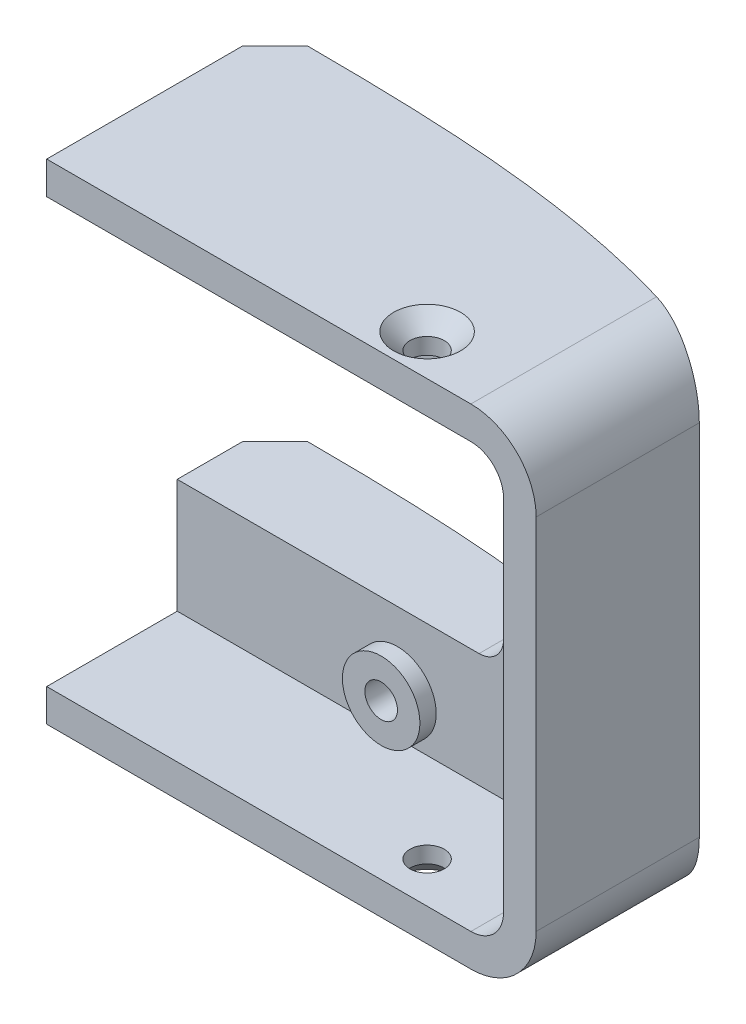
from build123d import *

# Parameters (mm, degrees)
SKETCH_2_W                    = 30
SKETCH_2_H                    = 30
EXTRUDE_1_DEPTH               = 10
SHELL_1_T                     = -2
CUT_EXTRUDE_1_REACH           = 34.104
SKETCH_3_W                    = 28
SKETCH_3_H                    = 26
EXTRUDE_2_DEPTH               = 30
CUT_EXTRUDE_2_DEPTH           = 34.566112599
SKETCH_6_R                    = 2.375
EXTRUDE_3_DEPTH               = 1
SKETCH_7_R                    = 1
CUT_EXTRUDE_3_DEPTH           = 3
CUT_EXTRUDE_3_DRAFT           = -2
CUT_EXTRUDE_3_PROFILE_2_DEPTH = 3
CUT_EXTRUDE_3_PROFILE_2_DRAFT = -2
CUT_EXTRUDE_3_PROFILE_3_DEPTH = 3
CUT_EXTRUDE_3_PROFILE_3_DRAFT = -2
CUT_EXTRUDE_3_PROFILE_4_DEPTH = 3
CUT_EXTRUDE_3_PROFILE_4_DRAFT = -2
FILLET_2_R                    = 2
FILLET_3_R                    = 4
SKETCH_8_R                    = 1.05
CUT_EXTRUDE_4_DEPTH           = 38.710498044
CHAMFER_1_SIZE                = 1
CHAMFER_2_SIZE                = 2.001261587
CHAMFER_2_SIZE_2              = 2


with BuildPart() as part:
    # 草图2 → 凸台-拉伸1 (new body)
    with BuildSketch(Plane.XY):
        with Locations((3.057614324, -9.588661073)):
            Rectangle(SKETCH_2_W, SKETCH_2_H)
    extrude(amount=-EXTRUDE_1_DEPTH)

    # 抽壳1
    shell_1_openings = [part.faces().sort_by_distance(p)[0] for p in [
        (-11.942385676, -9.588661073, -5),
    ]]
    offset(amount=SHELL_1_T, openings=shell_1_openings, kind=Kind.INTERSECTION)

    # 草图3 → 切除-拉伸1 (cut, up to next)
    with BuildSketch(Plane.XY, mode=Mode.PRIVATE) as cut_extrude_1_sk1:
        with Locations((2.057614324, -9.588661073)):
            Rectangle(SKETCH_3_W, SKETCH_3_H)
    cut_extrude_1_tool1 = extrude(cut_extrude_1_sk1.sketch, amount=-CUT_EXTRUDE_1_REACH, mode=Mode.PRIVATE) & part.part
    add(cut_extrude_1_tool1.solids().sort_by_distance((2.057614, -9.588661, 0))[0], mode=Mode.SUBTRACT)

    # 草图4 → 凸台-拉伸2 (add)
    with BuildSketch(Plane.XZ.offset(24.588661073)):
        with BuildLine():
            Line((-11.942385676, -10), (-11.942385676, -14))
            add(Edge.make_bspline(
                [(-11.942385676, -14), (-1.471769767, -14.006598556), (8.440678476, -13.813297469), (18.057614324, -10)],
                knots=[0, 0, 0, 0, 1, 1, 1, 1], degree=3))
            Line((18.057614324, -10), (-11.942385676, -10))
        make_face()
    extrude(amount=-EXTRUDE_2_DEPTH)

    # 草图5 → 切除-拉伸2 (cut, through all)
    with BuildSketch(Plane.XY):
        with BuildLine():
            Line((6.557614324, -3.588661073), (-11.942385676, -3.588661073))
            Line((-11.942385676, -3.588661073), (-11.942385676, -15.588661073))
            Line((-11.942385676, -15.588661073), (6.557614324, -15.588661073))
            ThreePointArc((6.557614324, -15.588661073), (7.618274496, -15.149321245), (8.057614324, -14.088661073))
            Line((8.057614324, -14.088661073), (8.057614324, -5.088661073))
            ThreePointArc((8.057614324, -5.088661073), (7.618274496, -4.028000901), (6.557614324, -3.588661073))
        make_face()
    extrude(amount=-CUT_EXTRUDE_2_DEPTH, mode=Mode.SUBTRACT)

    # 草图6 → 凸台-拉伸3 (add)
    with BuildSketch(Plane.XY.offset(-8)):
        with Locations(Location((1.557614324, 0.908700453, 0), (0, 0, 180))):
            Circle(SKETCH_6_R)
        with Locations((14.057614324, 0.908700453)):
            Circle(SKETCH_6_R)
        with Locations(Location((1.557614324, -20.091299547, 0), (0, 0, 180))):
            Circle(SKETCH_6_R)
        with Locations((14.057614324, -20.091299547)):
            Circle(SKETCH_6_R)
    extrude(amount=EXTRUDE_3_DEPTH)


with BuildPart() as cut_extrude_3_tool:
    # 草图7 → 切除-拉伸3 (with draft: the straight prism first)
    with BuildSketch(Plane.XY.offset(-7)):
        with Locations((1.557614324, -20.091299547)):
            Circle(SKETCH_7_R)
    extrude(amount=-CUT_EXTRUDE_3_DEPTH)
    # 切除-拉伸3: the draft: its side faces are tilted about the plane it starts from
    cut_extrude_3_sides = [cut_extrude_3_tool.faces().sort_by_distance(p)[0] for p in [
        (0.557614324, -20.091299547, -8.5),
    ]]
    draft(cut_extrude_3_sides, Plane.XY.offset(-7), CUT_EXTRUDE_3_DRAFT)


with BuildPart() as part_1:
    add(part.part)

    # 切除-拉伸3: cut by cut_extrude_3_tool
    add(cut_extrude_3_tool.part, mode=Mode.SUBTRACT)


with BuildPart() as cut_extrude_3_profile_2_tool:
    # 草图7 → 切除-拉伸3 profile 2 (with draft: the straight prism first)
    with BuildSketch(Plane.XY.offset(-7)):
        with Locations((14.057614324, -20.091299547)):
            Circle(SKETCH_7_R)
    extrude(amount=-CUT_EXTRUDE_3_PROFILE_2_DEPTH)
    # 切除-拉伸3 profile 2: the draft: its side faces are tilted about the plane it starts from
    cut_extrude_3_profile_2_sides = [cut_extrude_3_profile_2_tool.faces().sort_by_distance(p)[0] for p in [
        (13.057614324, -20.091299547, -8.5),
    ]]
    draft(cut_extrude_3_profile_2_sides, Plane.XY.offset(-7), CUT_EXTRUDE_3_PROFILE_2_DRAFT)


with BuildPart() as part_2:
    add(part_1.part)

    # 切除-拉伸3 profile 2: cut by cut_extrude_3_profile_2_tool
    add(cut_extrude_3_profile_2_tool.part, mode=Mode.SUBTRACT)


with BuildPart() as cut_extrude_3_profile_3_tool:
    # 草图7 → 切除-拉伸3 profile 3 (with draft: the straight prism first)
    with BuildSketch(Plane.XY.offset(-7)):
        with Locations((1.557614324, 0.908700453)):
            Circle(SKETCH_7_R)
    extrude(amount=-CUT_EXTRUDE_3_PROFILE_3_DEPTH)
    # 切除-拉伸3 profile 3: the draft: its side faces are tilted about the plane it starts from
    cut_extrude_3_profile_3_sides = [cut_extrude_3_profile_3_tool.faces().sort_by_distance(p)[0] for p in [
        (0.557614324, 0.908700453, -8.5),
    ]]
    draft(cut_extrude_3_profile_3_sides, Plane.XY.offset(-7), CUT_EXTRUDE_3_PROFILE_3_DRAFT)


with BuildPart() as part_3:
    add(part_2.part)

    # 切除-拉伸3 profile 3: cut by cut_extrude_3_profile_3_tool
    add(cut_extrude_3_profile_3_tool.part, mode=Mode.SUBTRACT)


with BuildPart() as cut_extrude_3_profile_4_tool:
    # 草图7 → 切除-拉伸3 profile 4 (with draft: the straight prism first)
    with BuildSketch(Plane.XY.offset(-7)):
        with Locations((14.057614324, 0.908700453)):
            Circle(SKETCH_7_R)
    extrude(amount=-CUT_EXTRUDE_3_PROFILE_4_DEPTH)
    # 切除-拉伸3 profile 4: the draft: its side faces are tilted about the plane it starts from
    cut_extrude_3_profile_4_sides = [cut_extrude_3_profile_4_tool.faces().sort_by_distance(p)[0] for p in [
        (13.057614324, 0.908700453, -8.5),
    ]]
    draft(cut_extrude_3_profile_4_sides, Plane.XY.offset(-7), CUT_EXTRUDE_3_PROFILE_4_DRAFT)


with BuildPart() as part_4:
    add(part_3.part)

    # 切除-拉伸3 profile 4: cut by cut_extrude_3_profile_4_tool
    add(cut_extrude_3_profile_4_tool.part, mode=Mode.SUBTRACT)

    # 圆角2
    fillet_2_edges = [part_4.edges().sort_by_distance(p)[0] for p in [
        (16.057614324, 3.411338927, -4),
        (16.057614324, -22.588661073, -4),
    ]]
    fillet(fillet_2_edges, radius=FILLET_2_R)

    # 圆角3
    fillet_3_edges = [part_4.edges().sort_by_distance(p)[0] for p in [
        (18.057614324, -24.588661073, -5),
        (18.057614324, 5.411338927, -5),
    ]]
    fillet(fillet_3_edges, radius=FILLET_3_R)

    # 草图8 → 切除-拉伸4 (cut, through all)
    with BuildSketch(Plane(origin=(0, 5.411338927, 0), x_dir=(1, 0, 0), z_dir=(0, 1, 0))):
        with Locations(Location((8.874069652, 2.5, 0), (0, 0, 180))):
            Circle(SKETCH_8_R)
    extrude(amount=-CUT_EXTRUDE_4_DEPTH, mode=Mode.SUBTRACT)

    # 倒角1
    chamfer_1_edges = [part_4.edges().sort_by_distance(p)[0] for p in [
        (9.924069652, -24.588661073, -2.5),
        (9.924069652, 5.411338927, -2.5),
    ]]
    chamfer(chamfer_1_edges, length=CHAMFER_1_SIZE)

    # 倒角2
    # the kernel refuses this chamfer: 2.001261587, 2 mm, written as the material it takes off along each edge
    with BuildSketch(Plane(origin=(-11.942385676, -8.735358117, -14), x_dir=(0.9999994656090836, 0, 0.0010338189141659818), z_dir=(0, 1, 0))) as chamfer_2_piece_1:
        with BuildLine():
            Line((1.996680257, 0), (CHAMFER_2_SIZE * 0.00103381891429, -CHAMFER_2_SIZE * 0.99999946573))
            Line((CHAMFER_2_SIZE * 0.00103381891429, -CHAMFER_2_SIZE * 0.99999946573), (0, 0))
            ThreePointArc((0, 0), (1.026596764, 0.000946618), (1.996680257, 0))
        make_face()
    extrude(amount=19.293394088, mode=Mode.SUBTRACT)
    with BuildSketch(Plane(origin=(-11.942385676, -29.732118676, -14), x_dir=(0.99999946423231, 0, 0.001035149792544402), z_dir=(0, 1, 0))) as chamfer_2_piece_2:
        with BuildLine():
            Line((1.997932911, 0), (CHAMFER_2_SIZE_2 * 0.00103514979254, -CHAMFER_2_SIZE_2 * 0.999999464232))
            Line((CHAMFER_2_SIZE_2 * 0.00103514979254, -CHAMFER_2_SIZE_2 * 0.999999464232), (0, 0))
            ThreePointArc((0, 0), (1.027240915, 0.000948024), (1.997932911, 0))
        make_face()
    extrude(amount=19.286915207, mode=Mode.SUBTRACT)


solid = part_4.part
